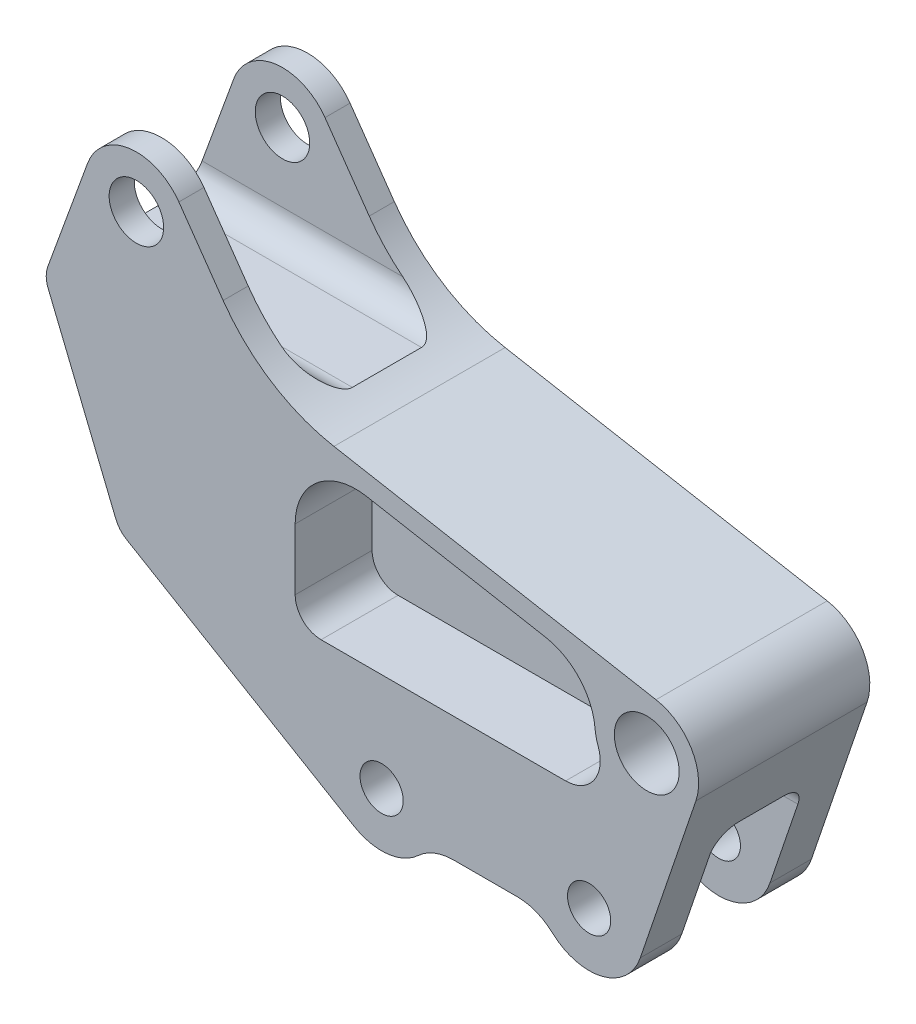
from build123d import *

# Parameters (mm, degrees)
SKETCH1_R           = 4.7625
SKETCH1_R_2         = 4
SKETCH1_R_3         = 3.175
BOSS_EXTRUDE1_DEPTH = 12.573
BOSS_EXTRUDE2_DEPTH = 1.27
SKETCH1_6_R         = 3.175
CUT_EXTRUDE1_DEPTH  = 6.477
SKETCH1_10_R        = 4
CUT_EXTRUDE3_DEPTH  = 8.89
FILLET1_R           = 3.81
FILLET3_R           = 3.81
FILLET4_R           = 3.175
FILLET5_R           = 7.62


with BuildPart() as part:
    # Sketch1 → Boss-Extrude1 (new body)
    with BuildSketch(Plane(origin=(0, 0, 0), x_dir=(0, 1, 0), z_dir=(0, 0, 1))):
        with BuildLine():
            Line((-26.499431941, 0.950631657), (-2.449998994, -7.215393609))
            ThreePointArc((-2.449998994, -7.215393609), (3.866048142, -6.56643524), (7.497932311, -1.358459074))
            Line((7.497932311, -1.358459074), (16.069122988, 45.94970705))
            ThreePointArc((16.069122988, 45.94970705), (19.672222889, 55.119231342), (26.493389209, 62.227972063))
            Line((26.493389209, 62.227972063), (35.774163974, 68.726440514))
            ThreePointArc((35.774163974, 68.726440514), (38.958321373, 75.962988676), (34.009705021, 82.128836862))
            Line((34.009705021, 82.128836862), (16.544511529, 88.485647429))
            Line((16.544511529, 88.485647429), (-10.358349656, 77.508379092))
            Line((-10.358349656, 77.508379092), (-30.779024566, 42.987968953))
            ThreePointArc((-30.779024566, 42.987968953), (-31.601546647, 36.844959103), (-27.757349656, 31.983348043))
            Line((-27.757349656, 31.983348043), (-27.757349656, 15.42998529))
            ThreePointArc((-27.757349656, 15.42998529), (-31.855063811, 7.779670964), (-26.499431941, 0.950631657))
        make_face()
        with Locations(Location((0, 0, 0), (0, 0, 270))):
            Circle(SKETCH1_R, mode=Mode.SUBTRACT)
        with Locations(Location((31.403511529, 74.968379092, 0), (0, 0, 270))):
            Circle(SKETCH1_R_2, mode=Mode.SUBTRACT)
        with Locations(Location((-23.947349656, 38.946666667, 0), (0, 0, 270))):
            Circle(SKETCH1_R_3, mode=Mode.SUBTRACT)
        with Locations(Location((-23.947349656, 8.466666667, 0), (0, 0, 270))):
            Circle(SKETCH1_R_3, mode=Mode.SUBTRACT)
        with BuildLine():
            Line((-9.469349656, 47.836666667), (-9.469349656, 11.917365883))
            ThreePointArc((-9.469349656, 11.917365883), (-7.295140555, 7.750499045), (-2.633609794, 7.15041953))
            ThreePointArc((-2.633609794, 7.15041953), (-1.656512431, 7.437766235), (-0.649822418, 7.592241489))
            ThreePointArc((-0.649822418, 7.592241489), (4.576435948, 9.875722251), (7.339639123, 14.86498764))
            Line((7.339639123, 14.86498764), (12.10584978, 41.171797748))
            ThreePointArc((12.10584978, 41.171797748), (10.181808987, 48.455026751), (3.358262084, 51.646666667))
            Line((3.358262084, 51.646666667), (-5.659349656, 51.646666667))
            ThreePointArc((-5.659349656, 51.646666667), (-8.353426493, 50.530743503), (-9.469349656, 47.836666667))
        make_face(mode=Mode.SUBTRACT)
    extrude(amount=BOSS_EXTRUDE1_DEPTH)

    # Sketch1<4> → Boss-Extrude2 (add)
    with BuildSketch(Plane(origin=(0, 0, 0), x_dir=(0, 1, 0), z_dir=(0, 0, 1))):
        with BuildLine():
            ThreePointArc((-5.659349656, 51.646666667), (-8.353426493, 50.530743503), (-9.469349656, 47.836666667))
            Line((-9.469349656, 47.836666667), (-9.469349656, 11.917365883))
            ThreePointArc((-9.469349656, 11.917365883), (-7.295140555, 7.750499045), (-2.633609794, 7.15041953))
            ThreePointArc((-2.633609794, 7.15041953), (-1.656512431, 7.437766235), (-0.649822418, 7.592241489))
            ThreePointArc((-0.649822418, 7.592241489), (4.576435948, 9.875722251), (7.339639123, 14.86498764))
            Line((7.339639123, 14.86498764), (12.10584978, 41.171797748))
            ThreePointArc((12.10584978, 41.171797748), (10.181808987, 48.455026751), (3.358262084, 51.646666667))
            Line((3.358262084, 51.646666667), (-5.659349656, 51.646666667))
        make_face()
    extrude(amount=BOSS_EXTRUDE2_DEPTH)

    # Sketch1<6> → Cut-Extrude1 (cut)
    with BuildSketch(Plane(origin=(0, 0, 0), x_dir=(0, 1, 0), z_dir=(0, 0, 1))):
        with BuildLine():
            ThreePointArc((-27.757349656, 15.42998529), (-31.855063811, 7.779670964), (-26.499431941, 0.950631657))
            Line((-26.499431941, 0.950631657), (-11.247349656, -4.228238446))
            Line((-11.247349656, -4.228238446), (-11.247349656, 51.646666667))
            Line((-11.247349656, 51.646666667), (-25.656940256, 51.646666667))
            Line((-25.656940256, 51.646666667), (-30.779024566, 42.987968953))
            ThreePointArc((-30.779024566, 42.987968953), (-31.601546647, 36.844959103), (-27.757349656, 31.983348043))
            Line((-27.757349656, 31.983348043), (-27.757349656, 15.42998529))
        make_face()
        with Locations(Location((-23.947349656, 8.466666667, 0), (0, 0, 270))):
            Circle(SKETCH1_6_R, mode=Mode.SUBTRACT)
        with Locations(Location((-23.947349656, 38.946666667, 0), (0, 0, 270))):
            Circle(SKETCH1_6_R, mode=Mode.SUBTRACT)
    extrude(amount=CUT_EXTRUDE1_DEPTH, mode=Mode.SUBTRACT)

    # Sketch1<10> → Cut-Extrude3 (cut)
    # profile 1 of 3: a face of its own
    with BuildSketch(Plane(origin=(0, 0, 0), x_dir=(0, 1, 0), z_dir=(0, 0, 1))):
        with BuildLine():
            Line((17.433511529, 88.162077891), (17.433511529, 50.740503147))
            ThreePointArc((17.433511529, 50.740503147), (21.118462359, 57.150658387), (26.493389209, 62.227972063))
            Line((26.493389209, 62.227972063), (35.774163974, 68.726440514))
            ThreePointArc((35.774163974, 68.726440514), (38.958321373, 75.962988676), (34.009705021, 82.128836862))
            Line((34.009705021, 82.128836862), (17.433511529, 88.162077891))
        make_face()
        with Locations(Location((31.403511529, 74.968379092, 0), (0, 0, 270))):
            Circle(SKETCH1_10_R, mode=Mode.SUBTRACT)
    # profile 2 of 3: a face of its own
    with BuildSketch(Plane(origin=(0, 0, 0), x_dir=(0, 1, 0), z_dir=(0, 0, 1))):
        Polygon((-11.247349656, 76.005556842), (-24.605157851, 53.424666667), (-11.247349656, 53.424666667), align=None)
    # profile 3 of 3: a face of its own
    with BuildSketch(Plane(origin=(0, 0, 0), x_dir=(0, 1, 0), z_dir=(0, 0, 1))):
        Polygon((15.655511529, 88.122905656), (-9.469349656, 77.871120864), (-9.469349656, 53.424666667), (15.655511529, 53.424666667), align=None)
    extrude(amount=CUT_EXTRUDE3_DEPTH, mode=Mode.SUBTRACT)

    # Mirror1: part across face


with BuildPart() as part_1:
    add(part.part)
    add(part.part.mirror(Plane(origin=(-30.744300958, 0.707665305, 0), x_dir=(1, 0, 0), z_dir=(0, 0, -1))))

    # Fillet1
    fillet1_edges = [part_1.edges().sort_by_distance(p)[0] for p in [
        (-69.451290519, 17.433511529, 8.89),
        (-51.646666667, -18.452144956, 6.477),
        (-51.646666667, -18.452144956, -6.477),
        (-53.424666667, -17.926253754, 8.89),
        (-53.424666667, -17.926253754, -8.89),
        (-70.773786162, 15.655511529, 8.89),
        (-65.647893765, -9.469349656, 8.89),
        (-65.647893765, -9.469349656, -8.89),
        (-70.773786162, 15.655511529, -8.89),
        (-69.451290519, 17.433511529, -8.89),
    ]]
    fillet(fillet1_edges, radius=FILLET1_R)

    # Fillet3
    # the kernel refuses this fillet: 3.81 mm, written as the material it takes off along each edge
    with BuildSketch(Plane(origin=(-77.508379092, -10.358349656, -15.77817458), x_dir=(-0.3777939966211631, 0.9258896781566412, 0), z_dir=(0, 0, 1))) as fillet3_piece_1:
        with BuildLine():
            CenterArc((FILLET3_R * 0.336501268256, -FILLET3_R), FILLET3_R, 90, 37.196303294)
            Line((-FILLET3_R * 0.268046453486, -FILLET3_R * 0.203431075087), (0, 0))
            Line((0, 0), (FILLET3_R * 0.336501268256, 0))
        make_face()
    extrude(amount=31.55634916, mode=Mode.SUBTRACT)
    with BuildSketch(Plane(origin=(-88.485647429, 16.544511529, -16.248115103), x_dir=(0.3420201433256622, 0.9396926207859108, 0), z_dir=(0, 0, 1))) as fillet3_piece_2:
        with BuildLine():
            CenterArc((FILLET3_R * 0.385838855973, -FILLET3_R), FILLET3_R, 90, 42.197104506)
            Line((-FILLET3_R * 0.285844295256, -FILLET3_R * 0.259161458646), (0, 0))
            Line((0, 0), (FILLET3_R * 0.385838855973, 0))
        make_face()
    extrude(amount=32.496230206, mode=Mode.SUBTRACT)

    # Fillet4
    fillet4_edges = [part_1.edges().sort_by_distance(p)[0] for p in [
        (-53.424666667, -11.247349656, 0),
        (-66.620111754, -11.247349656, -8.89),
        (-66.620111754, -11.247349656, 8.89),
        (-54.54058983, -11.247349656, -7.774076836),
        (-54.54058983, -11.247349656, 7.774076836),
        (-21.80421411, -11.247349656, 6.477),
        (-51.646666667, -11.247349656, 0),
        (-21.80421411, -11.247349656, -6.477),
        (-50.530743503, -11.247349656, -5.361076836),
        (-50.530743503, -11.247349656, 5.361076836),
    ]]
    fillet(fillet4_edges, radius=FILLET4_R)

    # Fillet5
    fillet5_edges = [part_1.edges().sort_by_distance(p)[0] for p in [
        (-31.983348043, -27.757349656, -9.525),
        (-15.42998529, -27.757349656, -9.525),
        (-15.42998529, -27.757349656, 9.525),
        (-31.983348043, -27.757349656, 9.525),
    ]]
    fillet(fillet5_edges, radius=FILLET5_R)


solid = part_1.part
